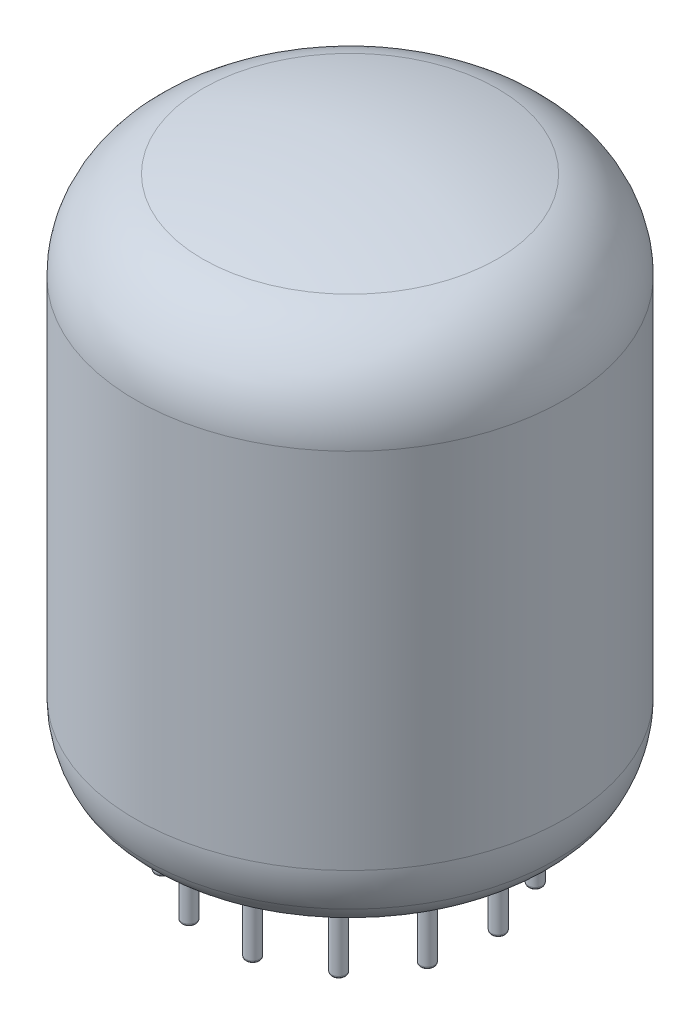
from build123d import *

# Parameters (mm, degrees)
BOSS_EXTRUDE2_START     = -5.969
BOSS_EXTRUDE2_OUTLINE_R = 0.508
BOSS_EXTRUDE2_DEPTH     = 11.43
FILLET2_R               = 0.1905
SKETCH4_R               = 13.335
BOSS_EXTRUDE3_DEPTH     = 0.5
SKETCH5_R               = 13.335
BOSS_EXTRUDE4_DEPTH     = 0.5
SKETCH6_W               = 4.402666666
SKETCH6_H               = 3.302
BOSS_EXTRUDE5_DEPTH     = 14
BOSS_EXTRUDE5_2_DEPTH   = 14
BOSS_EXTRUDE5_3_DEPTH   = 14


# Read off the part's stored shape, not the designer's step: Boss-Extrude2, CirPattern5
with BuildPart() as part:
    # Sketch1 → Revolve-Thin1 (revolve)
    with BuildSketch(Plane.XY, mode=Mode.PRIVATE) as revolve_thin1_sk:
        with BuildLine():
            ThreePointArc((0, 38.1), (5.293912531, 37.730418632), (10.48512, 36.628844625))
            ThreePointArc((10.48512, 36.628844625), (13.808066054, 34.346716091), (15.0876, 30.524037188))
            Line((15.0876, 30.524037188), (15.0876, 4.546102091))
            ThreePointArc((15.0876, 4.546102091), (14.929987533, 3.140101864), (14.464974287, 1.803897909))
            ThreePointArc((14.464974287, 1.803897909), (13.293530604, 0.488564244), (11.601287143, 0))
            Line((11.601287143, 0), (3.060575478, 0))
            ThreePointArc((3.060575478, 0), (2.657992523, -0.14392774), (2.437906749, -0.510466254))
            Line((2.437906749, -0.510466254), (1.372093251, -5.839533746))
            ThreePointArc((1.372093251, -5.839533746), (1.152007477, -6.20607226), (0.749424522, -6.35))
            Line((0.749424522, -6.35), (0, -6.35))
            Line((0, -6.35), (0, -6.604))
            Line((0, -6.604), (0.749424522, -6.604))
            ThreePointArc((0.749424522, -6.604), (1.313040659, -6.402501164), (1.621160742, -5.889347244))
            Line((1.621160742, -5.889347244), (2.686974241, -0.560279753))
            ThreePointArc((2.686974241, -0.560279753), (2.819025705, -0.340356644), (3.060575478, -0.254))
            Line((3.060575478, -0.254), (11.601287143, -0.254))
            ThreePointArc((11.601287143, -0.254), (13.428910081, 0.273649384), (14.694069258, 1.694209741))
            ThreePointArc((14.694069258, 1.694209741), (15.177683034, 3.083861855), (15.3416, 4.546102091))
            Line((15.3416, 4.546102091), (15.3416, 30.524037188))
            ThreePointArc((15.3416, 30.524037188), (14.010884696, 34.499623248), (10.5550208, 36.873036923))
            ThreePointArc((10.5550208, 36.873036923), (5.329205281, 37.981954756), (0, 38.354))
            Line((0, 38.354), (0, 38.1))
        make_face()
    revolve(revolve_thin1_sk.sketch.rotate(Axis((0, 0, 0), (0, 1, 0)), 90), axis=Axis((0, 0, 0), (0, 1, 0)))


with BuildPart() as body_2:
    # Boss-Extrude2 outline → Boss-Extrude2 (new body)
    with BuildSketch(Plane(origin=(0, 0, 0), x_dir=(1, 0, 0), z_dir=(0, 1, 0)).offset(BOSS_EXTRUDE2_START)):
        with Locations((-4.426488214, 8.433968644)):
            Circle(BOSS_EXTRUDE2_OUTLINE_R)
    extrude(amount=BOSS_EXTRUDE2_DEPTH)

    # Fillet2
    fillet2_edges = [body_2.edges().sort_by_distance(p)[0] for p in [
        (-4.934488214, -5.969, -8.433968644),
    ]]
    fillet(fillet2_edges, radius=FILLET2_R)


with BuildPart() as body_3:
    # CirPattern5 outline → CirPattern5 (revolve)
    with BuildSketch(Plane(origin=(4.426488214, 0, -8.433968644), x_dir=(1, 0, 0), z_dir=(0, 0, 1))):
        with BuildLine():
            Line((0.508, -5.7785), (0.508, 5.461))
            Line((0.508, 5.461), (0, 5.461))
            Line((0, 5.461), (0, -5.969))
            Line((0, -5.969), (0.3175, -5.969))
            ThreePointArc((0.3175, -5.969), (0.452203842, -5.913203842), (0.508, -5.7785))
        make_face()
    revolve(axis=Axis((4.426488214, 0, -8.433968644), (0, 1, 0)))


with BuildPart() as body_4:
    # CirPattern5 2 outline → CirPattern5 2 (revolve)
    with BuildSketch(Plane(origin=(7.838921323, 0, -5.410816713), x_dir=(1, 0, 0), z_dir=(0, 0, 1))):
        with BuildLine():
            Line((0.508, 5.461), (0, 5.461))
            Line((0, 5.461), (0, -5.969))
            Line((0, -5.969), (0.3175, -5.969))
            ThreePointArc((0.3175, -5.969), (0.452203842, -5.913203842), (0.508, -5.7785))
            Line((0.508, -5.7785), (0.508, 5.461))
        make_face()
    revolve(axis=Axis((7.838921323, 0, -5.410816713), (0, 1, 0)))


with BuildPart() as body_5:
    # CirPattern5 3 outline → CirPattern5 3 (revolve)
    with BuildSketch(Plane(origin=(9.455552026, 0, -1.148111879), x_dir=(1, 0, 0), z_dir=(0, 0, 1))):
        with BuildLine():
            Line((0.508, 5.461), (0, 5.461))
            Line((0, 5.461), (0, -5.969))
            Line((0, -5.969), (0.3175, -5.969))
            ThreePointArc((0.3175, -5.969), (0.452203842, -5.913203842), (0.508, -5.7785))
            Line((0.508, -5.7785), (0.508, 5.461))
        make_face()
    revolve(axis=Axis((9.455552026, 0, -1.148111879), (0, 1, 0)))


with BuildPart() as body_6:
    # CirPattern5 4 outline → CirPattern5 4 (revolve)
    with BuildSketch(Plane(origin=(8.906029712, 0, 3.377611549), x_dir=(1, 0, 0), z_dir=(0, 0, 1))):
        with BuildLine():
            Line((0.508, 5.461), (0, 5.461))
            Line((0, 5.461), (0, -5.969))
            Line((0, -5.969), (0.3175, -5.969))
            ThreePointArc((0.3175, -5.969), (0.452203842, -5.913203842), (0.508, -5.7785))
            Line((0.508, -5.7785), (0.508, 5.461))
        make_face()
    revolve(axis=Axis((8.906029712, 0, 3.377611549), (0, 1, 0)))


with BuildPart() as body_7:
    # CirPattern5 5 outline → CirPattern5 5 (revolve)
    with BuildSketch(Plane(origin=(6.31624332, 0, 7.129564876), x_dir=(1, 0, 0), z_dir=(0, 0, 1))):
        with BuildLine():
            Line((0.508, 5.461), (0, 5.461))
            Line((0, 5.461), (0, -5.969))
            Line((0, -5.969), (0.3175, -5.969))
            ThreePointArc((0.3175, -5.969), (0.452203842, -5.913203842), (0.508, -5.7785))
            Line((0.508, -5.7785), (0.508, 5.461))
        make_face()
    revolve(axis=Axis((6.31624332, 0, 7.129564876), (0, 1, 0)))


with BuildPart() as body_8:
    # CirPattern5 6 outline → CirPattern5 6 (revolve)
    with BuildSketch(Plane(origin=(2.279481702, 0, 9.248220811), x_dir=(1, 0, 0), z_dir=(0, 0, 1))):
        with BuildLine():
            Line((0.508, 5.461), (0, 5.461))
            Line((0, 5.461), (0, -5.969))
            Line((0, -5.969), (0.3175, -5.969))
            ThreePointArc((0.3175, -5.969), (0.452203842, -5.913203842), (0.508, -5.7785))
            Line((0.508, -5.7785), (0.508, 5.461))
        make_face()
    revolve(axis=Axis((2.279481702, 0, 9.248220811), (0, 1, 0)))


with BuildPart() as body_9:
    # CirPattern5 7 outline → CirPattern5 7 (revolve)
    with BuildSketch(Plane(origin=(-2.279481702, 0, 9.248220811), x_dir=(1, 0, 0), z_dir=(0, 0, 1))):
        with BuildLine():
            Line((0.508, 5.461), (0, 5.461))
            Line((0, 5.461), (0, -5.969))
            Line((0, -5.969), (0.3175, -5.969))
            ThreePointArc((0.3175, -5.969), (0.452203842, -5.913203842), (0.508, -5.7785))
            Line((0.508, -5.7785), (0.508, 5.461))
        make_face()
    revolve(axis=Axis((-2.279481702, 0, 9.248220811), (0, 1, 0)))


with BuildPart() as body_10:
    # CirPattern5 8 outline → CirPattern5 8 (revolve)
    with BuildSketch(Plane(origin=(-6.31624332, 0, 7.129564876), x_dir=(1, 0, 0), z_dir=(0, 0, 1))):
        with BuildLine():
            Line((0.508, 5.461), (0, 5.461))
            Line((0, 5.461), (0, -5.969))
            Line((0, -5.969), (0.3175, -5.969))
            ThreePointArc((0.3175, -5.969), (0.452203842, -5.913203842), (0.508, -5.7785))
            Line((0.508, -5.7785), (0.508, 5.461))
        make_face()
    revolve(axis=Axis((-6.31624332, 0, 7.129564876), (0, 1, 0)))


with BuildPart() as body_11:
    # CirPattern5 9 outline → CirPattern5 9 (revolve)
    with BuildSketch(Plane(origin=(-8.906029712, 0, 3.377611549), x_dir=(1, 0, 0), z_dir=(0, 0, 1))):
        with BuildLine():
            Line((0.508, 5.461), (0, 5.461))
            Line((0, 5.461), (0, -5.969))
            Line((0, -5.969), (0.3175, -5.969))
            ThreePointArc((0.3175, -5.969), (0.452203842, -5.913203842), (0.508, -5.7785))
            Line((0.508, -5.7785), (0.508, 5.461))
        make_face()
    revolve(axis=Axis((-8.906029712, 0, 3.377611549), (0, 1, 0)))


with BuildPart() as body_12:
    # CirPattern5 10 outline → CirPattern5 10 (revolve)
    with BuildSketch(Plane(origin=(-9.455552026, 0, -1.148111879), x_dir=(1, 0, 0), z_dir=(0, 0, 1))):
        with BuildLine():
            Line((0.508, 5.461), (0, 5.461))
            Line((0, 5.461), (0, -5.969))
            Line((0, -5.969), (0.3175, -5.969))
            ThreePointArc((0.3175, -5.969), (0.452203842, -5.913203842), (0.508, -5.7785))
            Line((0.508, -5.7785), (0.508, 5.461))
        make_face()
    revolve(axis=Axis((-9.455552026, 0, -1.148111879), (0, 1, 0)))


with BuildPart() as body_13:
    # CirPattern5 11 outline → CirPattern5 11 (revolve)
    with BuildSketch(Plane(origin=(-7.838921323, 0, -5.410816713), x_dir=(1, 0, 0), z_dir=(0, 0, 1))):
        with BuildLine():
            Line((0.508, 5.461), (0, 5.461))
            Line((0, 5.461), (0, -5.969))
            Line((0, -5.969), (0.3175, -5.969))
            ThreePointArc((0.3175, -5.969), (0.452203842, -5.913203842), (0.508, -5.7785))
            Line((0.508, -5.7785), (0.508, 5.461))
        make_face()
    revolve(axis=Axis((-7.838921323, 0, -5.410816713), (0, 1, 0)))


with BuildPart() as body_14:
    # Sketch4 → Boss-Extrude3 (new body)
    with BuildSketch(Plane(origin=(0, 15.524037188, 0), x_dir=(1, 0, 0), z_dir=(0, 1, 0))):
        with Locations(Location((0, 0, 0), (0, 0, 270))):
            Circle(SKETCH4_R)
    extrude(amount=BOSS_EXTRUDE3_DEPTH)


with BuildPart() as body_15:
    # Sketch5 → Boss-Extrude4 (new body)
    with BuildSketch(Plane(origin=(0, 30.524037188, 0), x_dir=(1, 0, 0), z_dir=(0, 1, 0))):
        with Locations(Location((0, 0, 0), (0, 0, 270))):
            Circle(SKETCH5_R)
    extrude(amount=-BOSS_EXTRUDE4_DEPTH)


with BuildPart() as body_16:
    # Sketch6 → Boss-Extrude5 (new body)
    with BuildSketch(Plane(origin=(0, 16.024037188, 0), x_dir=(1, 0, 0), z_dir=(0, 1, 0))):
        Polygon((0.254, 1.905), (2.54, 1.905), (2.54, -1.905), (0.254, -1.905), (0.254, -4.445), (-0.254, -4.445), (-0.254, -1.905), (-2.54, -1.905), (-2.54, 1.905), (-0.254, 1.905), (-0.254, 4.445), (0.254, 4.445), align=None)
        Rectangle(SKETCH6_W, SKETCH6_H, mode=Mode.SUBTRACT)
    extrude(amount=BOSS_EXTRUDE5_DEPTH)


with BuildPart() as body_17:
    # Sketch6 → Boss-Extrude5 2 (new body)
    with BuildSketch(Plane(origin=(0, 16.024037188, 0), x_dir=(1, 0, 0), z_dir=(0, 1, 0))):
        Polygon((3.81, 1.905), (6.096, 1.905), (6.096, 4.445), (6.604, 4.445), (6.604, 1.905), (8.89, 1.905), (8.89, -1.905), (6.604, -1.905), (6.604, -4.445), (6.096, -4.445), (6.096, -1.905), (3.81, -1.905), align=None)
        with Locations((6.35, 0)):
            Rectangle(SKETCH6_W, SKETCH6_H, mode=Mode.SUBTRACT)
    extrude(amount=BOSS_EXTRUDE5_2_DEPTH)


with BuildPart() as body_18:
    # Sketch6 → Boss-Extrude5 3 (new body)
    with BuildSketch(Plane(origin=(0, 16.024037188, 0), x_dir=(1, 0, 0), z_dir=(0, 1, 0))):
        Polygon((-8.89, 1.905), (-6.604, 1.905), (-6.604, 4.445), (-6.096, 4.445), (-6.096, 1.905), (-3.81, 1.905), (-3.81, -1.905), (-6.096, -1.905), (-6.096, -4.445), (-6.604, -4.445), (-6.604, -1.905), (-8.89, -1.905), align=None)
        with Locations((-6.35, 0)):
            Rectangle(SKETCH6_W, SKETCH6_H, mode=Mode.SUBTRACT)
    extrude(amount=BOSS_EXTRUDE5_3_DEPTH)


solid = Compound([part.part, body_2.part, body_3.part, body_4.part, body_5.part, body_6.part, body_7.part, body_8.part, body_9.part, body_10.part, body_11.part, body_12.part, body_13.part, body_14.part, body_15.part, body_16.part, body_17.part, body_18.part])
